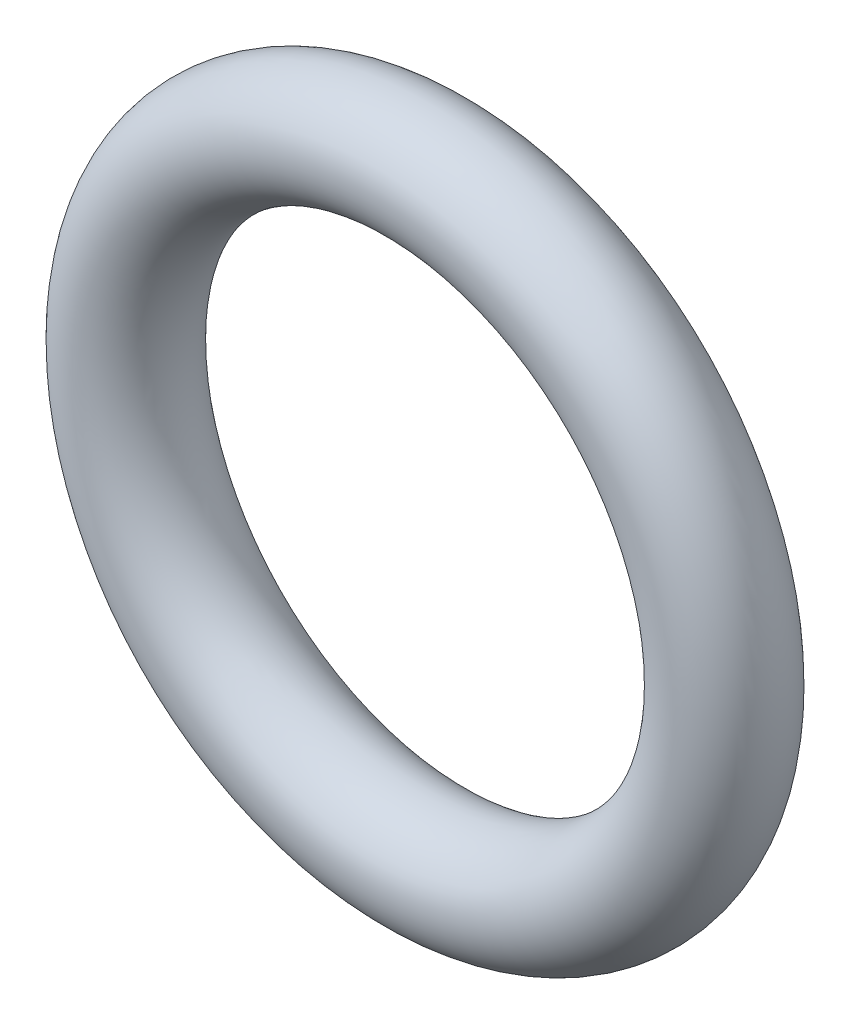
from build123d import *

# Parameters (mm, degrees)
SKETCH1_R = 0.889


with BuildPart() as part:
    # Sketch1 → Revolve1 (revolve)
    with BuildSketch(Plane(origin=(0, 0, 0), x_dir=(0, -1, 0), z_dir=(1, 0, 0))):
        with Locations((4.7117, 0)):
            Circle(SKETCH1_R)
    revolve(axis=Axis((0, 0, -0.9779), (0, 0, 1)))


solid = part.part
